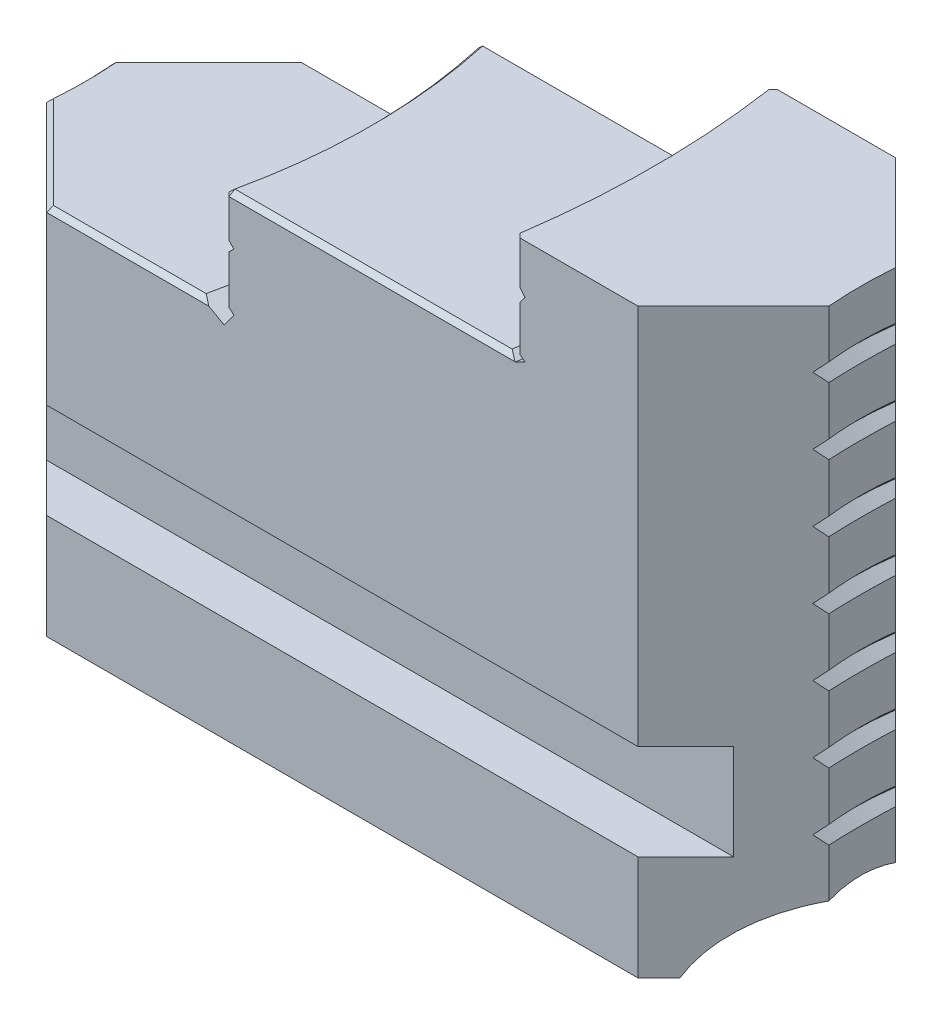
from build123d import *
from OCP.BRepFilletAPI import BRepFilletAPI_MakeChamfer

# Parameters (mm, degrees)
SKETCH1_W           = 82
SKETCH1_H           = 26.97
BOSS_EXTRUDE1_DEPTH = 61
CHAMFER1_SIZE       = 10
SKETCH2_R           = 42.289934081
CUT_EXTRUDE1_DEPTH  = 75.725131147
LPATTERN1_COUNT     = 8
LPATTERN1_PITCH     = 7
CHAMFER2_SIZE       = 0.5
CHAMFER2_SIZE2      = 0.439157148
CHAMFER2_SIZE2_2    = 0.416956291
SKETCH23_R          = 10
SKETCH23_W          = 5.01
SKETCH23_H          = 10.01
CUT_EXTRUDE2_DEPTH  = 100
SKETCH24_R          = 12.25
CUT_EXTRUDE3_DEPTH  = 10
CUT_EXTRUDE4_START  = 72
SKETCH24_2_R        = 12.25
CUT_EXTRUDE4_DEPTH  = 10
CUT_SWEEP1_PITCH    = 4


with BuildPart() as part:
    # Sketch1 → Boss-Extrude1 (new body)
    with BuildSketch(Plane(origin=(0, 0, 0), x_dir=(1, 0, 0), z_dir=(0, 1, 0))):
        Rectangle(SKETCH1_W, SKETCH1_H)
    extrude(amount=BOSS_EXTRUDE1_DEPTH)

    # Chamfer1
    chamfer1_edges = [part.edges().sort_by_distance(p)[0] for p in [
        (-41, 30.5, -13.485),
        (41, 30.5, -13.485),
        (41, 30.5, 13.485),
        (-41, 30.5, 13.485),
    ]]
    chamfer(chamfer1_edges, length=CHAMFER1_SIZE)

    # Sketch2 → Cut-Extrude1 (cut, through all)
    with BuildSketch(Plane(origin=(0, 61, 0), x_dir=(1, 0, 0), z_dir=(0, 1, 0))):
        with Locations((83.146094713, 0)):
            Circle(SKETCH2_R)
    cut_extrude1 = extrude(amount=-CUT_EXTRUDE1_DEPTH, mode=Mode.SUBTRACT)

    # Mirror1: Cut-Extrude1 across plane
    add(cut_extrude1.mirror(Plane(origin=(0, 0, 0), x_dir=(0, 0, 1), z_dir=(1, 0, 0))), mode=Mode.SUBTRACT)

    # Sketch19 → Cut-Revolve3 (revolve, cut)
    with BuildSketch(Plane.XY):
        Polygon((40.856160632, 56), (39.856160632, 55), (40.856160632, 54), align=None)
    cut_revolve3 = revolve(axis=Axis((70.856160632, 56, 0), (0, 1, 0)), mode=Mode.SUBTRACT)

    # LPattern1: Cut-Revolve3 ×8
    with Locations(*[(0, -i * LPATTERN1_PITCH, 0) for i in range(1, LPATTERN1_COUNT)]):
        add(cut_revolve3, mode=Mode.SUBTRACT)

    # Mirror2: Cut-Revolve3 across plane
    add(cut_revolve3.mirror(Plane(origin=(0, 0, 0), x_dir=(0, 0, 1), z_dir=(1, 0, 0))), mode=Mode.SUBTRACT)

    # Mirror2 copy 1 sketch → Mirror2 copy 1 (revolve, cut)
    with BuildSketch(Plane(origin=(0, -7, 0), x_dir=(-1, 0, 0), z_dir=(0, 0, 1))):
        Polygon((40.856160632, -56), (39.856160632, -55), (40.856160632, -54), align=None)
    revolve(axis=Axis((-70.856160632, 49, 0), (0, -1, 0)), mode=Mode.SUBTRACT)

    # Mirror2 copy 2 sketch → Mirror2 copy 2 (revolve, cut)
    with BuildSketch(Plane(origin=(0, -14, 0), x_dir=(-1, 0, 0), z_dir=(0, 0, 1))):
        Polygon((40.856160632, -56), (39.856160632, -55), (40.856160632, -54), align=None)
    revolve(axis=Axis((-70.856160632, 42, 0), (0, -1, 0)), mode=Mode.SUBTRACT)

    # Mirror2 copy 3 sketch → Mirror2 copy 3 (revolve, cut)
    with BuildSketch(Plane(origin=(0, -21, 0), x_dir=(-1, 0, 0), z_dir=(0, 0, 1))):
        Polygon((40.856160632, -56), (39.856160632, -55), (40.856160632, -54), align=None)
    revolve(axis=Axis((-70.856160632, 35, 0), (0, -1, 0)), mode=Mode.SUBTRACT)

    # Mirror2 copy 4 sketch → Mirror2 copy 4 (revolve, cut)
    with BuildSketch(Plane(origin=(0, -28, 0), x_dir=(-1, 0, 0), z_dir=(0, 0, 1))):
        Polygon((40.856160632, -56), (39.856160632, -55), (40.856160632, -54), align=None)
    revolve(axis=Axis((-70.856160632, 28, 0), (0, -1, 0)), mode=Mode.SUBTRACT)

    # Mirror2 copy 5 sketch → Mirror2 copy 5 (revolve, cut)
    with BuildSketch(Plane(origin=(0, -35, 0), x_dir=(-1, 0, 0), z_dir=(0, 0, 1))):
        Polygon((40.856160632, -56), (39.856160632, -55), (40.856160632, -54), align=None)
    revolve(axis=Axis((-70.856160632, 21, 0), (0, -1, 0)), mode=Mode.SUBTRACT)

    # Mirror2 copy 6 sketch → Mirror2 copy 6 (revolve, cut)
    with BuildSketch(Plane(origin=(0, -42, 0), x_dir=(-1, 0, 0), z_dir=(0, 0, 1))):
        Polygon((40.856160632, -56), (39.856160632, -55), (40.856160632, -54), align=None)
    revolve(axis=Axis((-70.856160632, 14, 0), (0, -1, 0)), mode=Mode.SUBTRACT)

    # Mirror2 copy 7 sketch → Mirror2 copy 7 (revolve, cut)
    with BuildSketch(Plane(origin=(0, -49, 0), x_dir=(-1, 0, 0), z_dir=(0, 0, 1))):
        Polygon((40.856160632, -56), (39.856160632, -55), (40.856160632, -54), align=None)
    revolve(axis=Axis((-70.856160632, 7, 0), (0, -1, 0)), mode=Mode.SUBTRACT)

    # Sketch20 → Cut-Revolve4 (revolve, cut)
    with BuildSketch(Plane.XY):
        Polygon((19.143839368, 61), (19.143839368, 57.171743666), (20.143839368, 55.847647784), (19.143839368, 54.523551901), (19.143839368, 50.841609773), (20.143839368, 50.002510142), (19.143839368, 49.487909541), (18.252524981, 50.002510142), (-10.856160632, 50.002510142), (-10.856160632, 46.002510142), (-9.856160632, 45.002510142), (-10.856160632, 44.002510142), (-10.856160632, 39.841609773), (-9.856160632, 39.002510142), (-10.856160632, 37.596036018), (-13.292245273, 39.002510142), (-40.856160632, 39.002510142), (-40.856160632, 61), align=None)
    revolve(axis=Axis((-70.856160632, 71.830704183, 0), (0, -1, 0)), mode=Mode.SUBTRACT)

    # Chamfer2: one chamfer whose edges measure the first distance from different faces: ONE call of the kernel's chamfer builder (chamfer() names one face for all edges)
    chamfer2_edges_1 = [part.edges().sort_by_distance(p)[0] for p in [
        (18.127853522, 59.085871833, -13.485),
        (18.127853522, 52.682580837, -13.485),
    ]]
    chamfer2_side_1 = [part.faces().sort_by_distance(p)[0] for p in [
        (2.615238182, 25.067664237, -13.485),
    ]]
    chamfer2_edges_2 = [part.edges().sort_by_distance(p)[0] for p in [
        (18.127853522, 59.085871833, 13.485),
        (18.127853522, 52.682580837, 13.485),
    ]]
    chamfer2_side_2 = [part.faces().sort_by_distance(p)[0] for p in [
        (2.615238182, 25.067664237, 13.485),
    ]]
    chamfer2_edges_3 = [part.edges().sort_by_distance(p)[0] for p in [
        (2.417542923, 50.002510142, 13.485),
        (2.417542923, 50.002510142, -13.485),
        (-10.856160632, 50.002510142, 0),
        (-22.947019192, 39.002510142, -13.485),
        (-36, 39.002510142, -8.485),
        (-40.856160632, 39.002510142, 0),
        (-36, 39.002510142, 8.485),
        (-22.947019192, 39.002510142, 13.485),
    ]]
    chamfer2_edges_4 = [part.edges().sort_by_distance(p)[0] for p in [
        (-12.391173033, 48.002510142, -13.485),
        (-12.391173033, 41.922059957, -13.485),
    ]]
    chamfer2_side_4 = [part.faces().sort_by_distance(p)[0] for p in [
        (2.615238182, 25.067664237, -13.485),
    ]]
    chamfer2_edges_5 = [part.edges().sort_by_distance(p)[0] for p in [
        (-12.391173033, 48.002510142, 13.485),
        (-12.391173033, 41.922059957, 13.485),
    ]]
    chamfer2_side_5 = [part.faces().sort_by_distance(p)[0] for p in [
        (2.615238182, 25.067664237, 13.485),
    ]]
    chamfer2 = BRepFilletAPI_MakeChamfer(part.part.solid().wrapped)
    for e in chamfer2_edges_1:
        chamfer2.Add(CHAMFER2_SIZE, CHAMFER2_SIZE2, e.wrapped, chamfer2_side_1[0].wrapped)  # the first distance lies on this face
    for e in chamfer2_edges_2:
        chamfer2.Add(CHAMFER2_SIZE, CHAMFER2_SIZE2, e.wrapped, chamfer2_side_2[0].wrapped)  # the first distance lies on this face
    for e in chamfer2_edges_3:
        chamfer2.Add(CHAMFER2_SIZE, e.wrapped)
    for e in chamfer2_edges_4:
        chamfer2.Add(CHAMFER2_SIZE, CHAMFER2_SIZE2_2, e.wrapped, chamfer2_side_4[0].wrapped)  # the first distance lies on this face
    for e in chamfer2_edges_5:
        chamfer2.Add(CHAMFER2_SIZE, CHAMFER2_SIZE2_2, e.wrapped, chamfer2_side_5[0].wrapped)  # the first distance lies on this face
    add(Compound.cast(chamfer2.Shape()), mode=Mode.REPLACE)

    # Sketch23 → Cut-Extrude2 (cut)
    with BuildSketch(Plane(origin=(-41, 0, 0), x_dir=(0, 0, -1), z_dir=(1, 0, 0))):
        with Locations((0, -4.75)):
            Circle(SKETCH23_R)
        with Locations((10.98, 16.005)):
            Rectangle(SKETCH23_W, SKETCH23_H)
        with Locations((-10.98, 16.005)):
            Rectangle(SKETCH23_W, SKETCH23_H)
    extrude(amount=CUT_EXTRUDE2_DEPTH, mode=Mode.SUBTRACT)

    # Sketch24 → Cut-Extrude3 (cut)
    with BuildSketch(Plane(origin=(-41, 0, 0), x_dir=(0, 0, -1), z_dir=(1, 0, 0))):
        with Locations((0, -4.75)):
            Circle(SKETCH24_R)
    extrude(amount=CUT_EXTRUDE3_DEPTH, mode=Mode.SUBTRACT)

    # Sketch24<2> → Cut-Extrude4 (cut)
    with BuildSketch(Plane(origin=(-41, 0, 0), x_dir=(0, 0, -1), z_dir=(1, 0, 0)).offset(CUT_EXTRUDE4_START)):
        with Locations((0, -4.75)):
            Circle(SKETCH24_2_R)
    extrude(amount=CUT_EXTRUDE4_DEPTH, mode=Mode.SUBTRACT)

    # Cut-Sweep1: the profile of Sketch26 profile screwed along a right-hand helix of 21.375 turns, 12 arcs to a turn; built about Z, then put on its axis
    cut_sweep1_z = Axis((0, 0, 0), (0, 0, 1))
    cut_sweep1_corners = [(12.2503, 0, 0), (12.2503, 0, -2), (9.25, 0, -2), (9.25, 0, 0)]
    with BuildLine(mode=Mode.PRIVATE) as cut_sweep1_profile:
        Line(cut_sweep1_corners[0], cut_sweep1_corners[1])
        Line(cut_sweep1_corners[1], cut_sweep1_corners[2])
        Line(cut_sweep1_corners[2], cut_sweep1_corners[3])
        Line(cut_sweep1_corners[3], cut_sweep1_corners[0])
    cut_sweep1_cap = Face(cut_sweep1_profile.wire())
    cut_sweep1_turn_angles = [0, 15, 30, 45, 60, 75, 90, 105, 120, 135, 150, 165, 180, 195, 210, 225, 240, 255, 270, 285, 300, 315, 330, 345, 360]
    cut_sweep1_turn_weights = [1, 0.9659258262890683, 1, 0.9659258262890683, 1, 0.9659258262890683, 1, 0.9659258262890683, 1, 0.9659258262890683, 1, 0.9659258262890683, 1, 0.9659258262890683, 1, 0.9659258262890683, 1, 0.9659258262890683, 1, 0.9659258262890683, 1, 0.9659258262890683, 1, 0.9659258262890683, 1]
    cut_sweep1_turn_rails = [Edge.make_bspline([Vector(p[0], p[1], 0).rotate(cut_sweep1_z, cut_sweep1_turn_angles[k]) / cut_sweep1_turn_weights[k] + Vector(0, 0, p[2] + CUT_SWEEP1_PITCH * cut_sweep1_turn_angles[k] / 360) for k in range(25)], [0, 0, 0, 1, 1, 2, 2, 3, 3, 4, 4, 5, 5, 6, 6, 7, 7, 8, 8, 9, 9, 10, 10, 11, 11, 12, 12, 12], 2, cut_sweep1_turn_weights) for p in cut_sweep1_corners]
    cut_sweep1_turn_sides = [Face.make_surface_from_curves(cut_sweep1_turn_rails[p[0]], cut_sweep1_turn_rails[p[1]]) for p in [(0, 1), (1, 2), (2, 3), (3, 0)]]
    cut_sweep1_last_angles = [7560, 7575, 7590, 7605, 7620, 7635, 7650, 7665, 7680, 7687.5, 7695]
    cut_sweep1_last_weights = [1, 0.9659258262890683, 1, 0.9659258262890683, 1, 0.9659258262890683, 1, 0.9659258262890683, 1, 0.9914448613738022, 1]
    cut_sweep1_last_rails = [Edge.make_bspline([Vector(p[0], p[1], 0).rotate(cut_sweep1_z, cut_sweep1_last_angles[k]) / cut_sweep1_last_weights[k] + Vector(0, 0, p[2] + CUT_SWEEP1_PITCH * cut_sweep1_last_angles[k] / 360) for k in range(11)], [0, 0, 0, 1, 1, 2, 2, 3, 3, 4, 4, 5, 5, 5], 2, cut_sweep1_last_weights) for p in cut_sweep1_corners]
    cut_sweep1_last_sides = [Face.make_surface_from_curves(cut_sweep1_last_rails[p[0]], cut_sweep1_last_rails[p[1]]) for p in [(0, 1), (1, 2), (2, 3), (3, 0)]]
    cut_sweep1 = Plane(origin=(-41, -4.75, 0), x_dir=(0, 1, 0), z_dir=(1, 0, 0)) * Solid(Shell([*[p.moved(Location((0, 0, CUT_SWEEP1_PITCH * i))) for i in range(21) for p in cut_sweep1_turn_sides], *cut_sweep1_last_sides, cut_sweep1_cap, cut_sweep1_cap.rotate(cut_sweep1_z, 7695).moved(Location((0, 0, CUT_SWEEP1_PITCH * 7695 / 360)))]))
    add(cut_sweep1, mode=Mode.SUBTRACT)


solid = part.part
